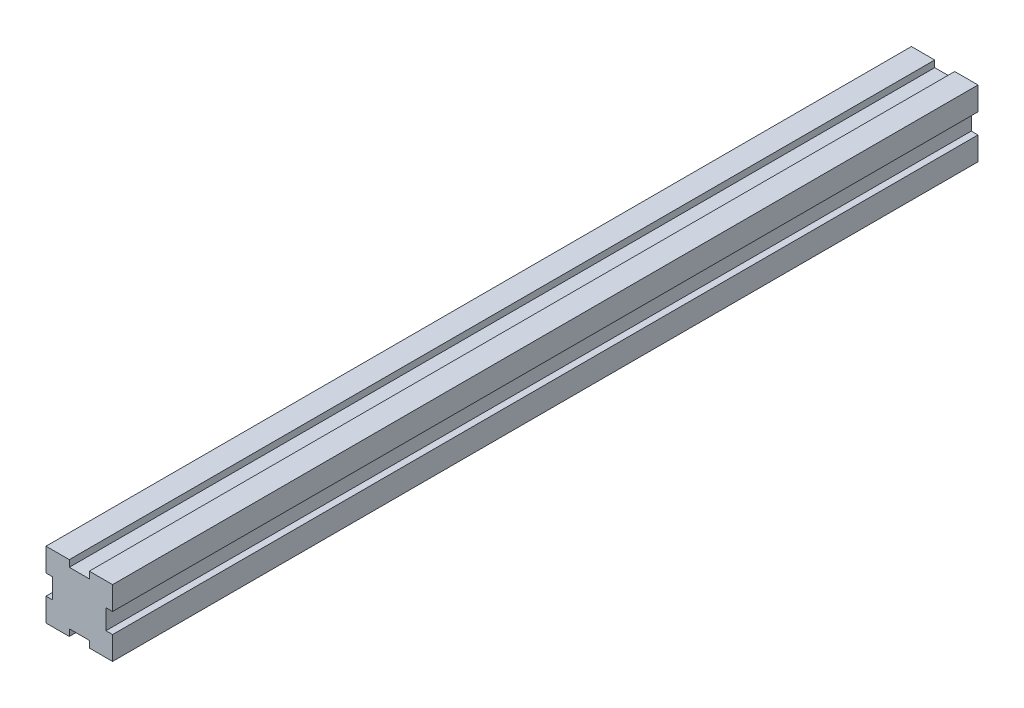
from build123d import *

# Parameters (mm, degrees)
EXTRUDE_1_DEPTH = 260


with BuildPart() as part:
    # 草图1 → 凸台-拉伸1 (new body)
    with BuildSketch(Plane.XY):
        Polygon((0, -13), (0, -20), (7, -20), (7, -18), (13, -18), (13, -20), (20, -20), (20, -13), (18, -13), (18, -7), (20, -7), (20, 0), (13, 0), (13, -2), (7, -2), (7, 0), (0, 0), (0, -7), (2, -7), (2, -13), align=None)
    extrude(amount=EXTRUDE_1_DEPTH)


solid = part.part
